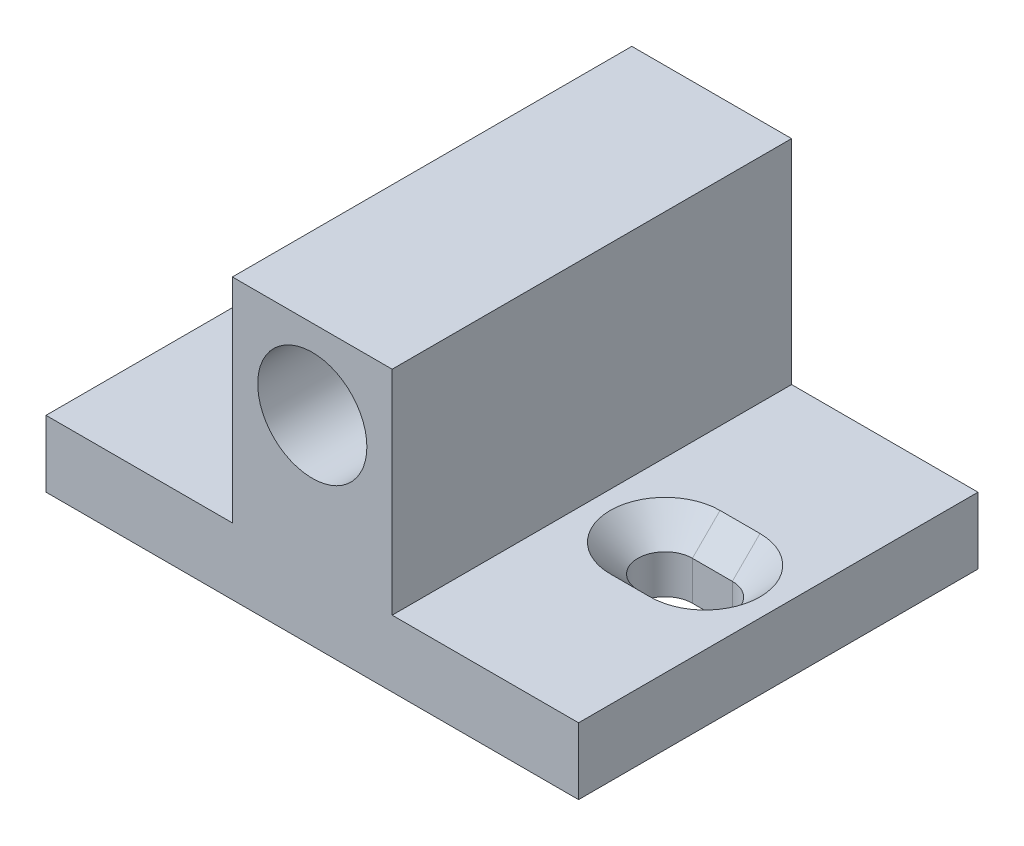
from build123d import *

# Parameters (mm, degrees)
SKIZZE1_W                                      = 40
SKIZZE1_H                                      = 30
AUFSATZ_LINEAR_AUSTRAGEN1_DEPTH                = 5
SKIZZE3_W                                      = 12
SKIZZE3_H                                      = 30
AUFSATZ_LINEAR_AUSTRAGEN2_DEPTH                = 16
SKIZZE4_R                                      = 4.1
SCHNITT_LINEAR_AUSTRAGEN1_DEPTH                = 25
FORMSENKUNG_LANGLOCH_F_R_M3_SENKSCHRAUBE_DEPTH = 5


with BuildPart() as part:
    # Skizze1 → Aufsatz-Linear austragen1 (new body)
    with BuildSketch(Plane(origin=(0, 0, 0), x_dir=(1, 0, 0), z_dir=(0, 1, 0))):
        Rectangle(SKIZZE1_W, SKIZZE1_H)
    extrude(amount=AUFSATZ_LINEAR_AUSTRAGEN1_DEPTH)

    # Skizze3 → Aufsatz-Linear austragen2 (add)
    with BuildSketch(Plane(origin=(0, 5, 0), x_dir=(1, 0, 0), z_dir=(0, 1, 0))):
        Rectangle(SKIZZE3_W, SKIZZE3_H)
    extrude(amount=AUFSATZ_LINEAR_AUSTRAGEN2_DEPTH)

    # Skizze4 → Schnitt-Linear austragen1 (cut)
    with BuildSketch(Plane.XY.offset(15)):
        with Locations((0, 15)):
            Circle(SKIZZE4_R)
    extrude(amount=-SCHNITT_LINEAR_AUSTRAGEN1_DEPTH, mode=Mode.SUBTRACT)

    # Formsenkung Langloch für M3 Senkschraube mit Schlitz/Kreuzschlitz1: read off the stored shape, not the designer's step
    # Formsenkung Langloch f_r M3 Senkschr 2 → Formsenkung Langloch für M3 Senkschraube mit Schlitz/Kreuzschlitz1 (cut)
    with BuildSketch(Plane(origin=(0, 0, 0), x_dir=(1, 0, 0), z_dir=(0, 1, 0))):
        with BuildLine():
            Line((-14.5, -2.05), (-11.5, -2.05))
            ThreePointArc((-11.5, -2.05), (-9.45, 0), (-11.5, 2.05))
            Line((-11.5, 2.05), (-14.5, 2.05))
            ThreePointArc((-14.5, 2.05), (-16.55, 0), (-14.5, -2.05))
        make_face()
    formsenkung_langloch_f_r_m3_senkschraube = extrude(amount=FORMSENKUNG_LANGLOCH_F_R_M3_SENKSCHRAUBE_DEPTH, mode=Mode.SUBTRACT)

    # Formsenkung Langloch f_r M3 Senkschr 3: loft between two sections, ruled curve by curve
    formsenkung_langloch_f_r_m3_senkschr_3_from = [
        Edge.make_three_point_arc((-11.5, 2.925, 2.05), (-10.050431099, 2.925, 1.449568901), (-9.45, 2.925, 0)),
        Edge.make_three_point_arc((-9.45, 2.925, 0), (-10.050431099, 2.925, -1.449568901), (-11.5, 2.925, -2.05)),
        Edge.make_three_point_arc((-14.5, 2.925, -2.05), (-15.949568901, 2.925, -1.449568901), (-16.55, 2.925, 0)),
        Edge.make_three_point_arc((-16.55, 2.925, 0), (-15.949568901, 2.925, 1.449568901), (-14.5, 2.925, 2.05)),
        Edge.make_line((-11.5, 2.925, -2.05), (-14.5, 2.925, -2.05)),
        Edge.make_line((-11.5, 2.925, 2.05), (-14.5, 2.925, 2.05)),
    ]
    formsenkung_langloch_f_r_m3_senkschr_3_to = [
        Edge.make_three_point_arc((-11.5, 5, 4.125), (-8.583184528, 5, 2.916815472), (-7.375, 5, 0)),
        Edge.make_three_point_arc((-7.375, 5, 0), (-8.583184528, 5, -2.916815472), (-11.5, 5, -4.125)),
        Edge.make_three_point_arc((-14.5, 5, -4.125), (-17.416815472, 5, -2.916815472), (-18.625, 5, 0)),
        Edge.make_three_point_arc((-18.625, 5, 0), (-17.416815472, 5, 2.916815472), (-14.5, 5, 4.125)),
        Edge.make_line((-11.5, 5, -4.125), (-14.5, 5, -4.125)),
        Edge.make_line((-11.5, 5, 4.125), (-14.5, 5, 4.125)),
    ]
    formsenkung_langloch_f_r_m3_senkschr_3 = Solid(Shell([*[Face.make_surface_from_curves(formsenkung_langloch_f_r_m3_senkschr_3_from[k], formsenkung_langloch_f_r_m3_senkschr_3_to[k]) for k in range(6)], Face(Wire(formsenkung_langloch_f_r_m3_senkschr_3_from)), Face(Wire(formsenkung_langloch_f_r_m3_senkschr_3_to))]))
    add(formsenkung_langloch_f_r_m3_senkschr_3, mode=Mode.SUBTRACT)

    # Spiegeln1: Formsenkung Langloch für M3 Senkschraube mit Schlitz/Kreuzschlitz1, Formsenkung Langloch f_r M3 Senkschr 3 across plane
    add(formsenkung_langloch_f_r_m3_senkschraube.mirror(Plane(origin=(0, 0, 0), x_dir=(0, 0, 1), z_dir=(1, 0, 0))), mode=Mode.SUBTRACT)
    add(formsenkung_langloch_f_r_m3_senkschr_3.mirror(Plane(origin=(0, 0, 0), x_dir=(0, 0, 1), z_dir=(1, 0, 0))), mode=Mode.SUBTRACT)


solid = part.part
